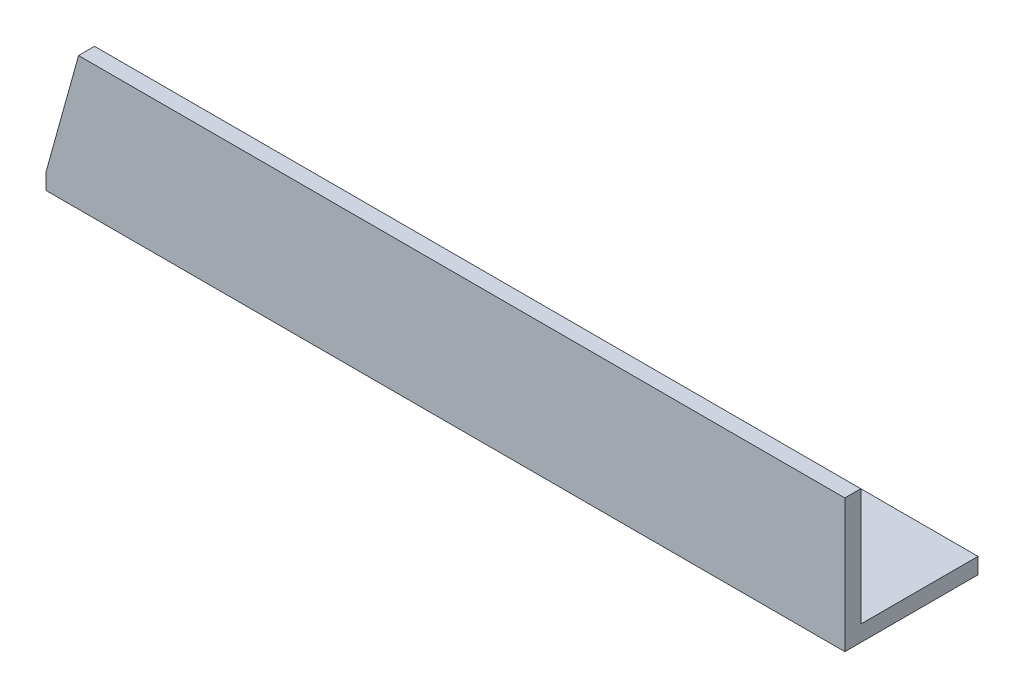
from build123d import *

# Parameters (mm, degrees)
EXTRUDE_1_DEPTH     = 300
CUT_EXTRUDE_1_DEPTH = 309.220700148


with BuildPart() as part:
    # Эскиз1 → Вытянуть-Тонкостенный1 (new body)
    with BuildSketch(Plane(origin=(0, 0, 0), x_dir=(0, 0, -1), z_dir=(1, 0, 0))):
        Polygon((0, 50), (0, 0), (50, 0), (50, 6), (6, 6), (6, 50), align=None)
    extrude(amount=EXTRUDE_1_DEPTH)

    # Эскиз2 → Вырез-Вытянуть1 (cut, through all)
    with BuildSketch(Plane.XY):
        Polygon((0, 50), (12.226487967, 50), (0, 6), align=None)
    extrude(amount=-CUT_EXTRUDE_1_DEPTH, mode=Mode.SUBTRACT)


solid = part.part
